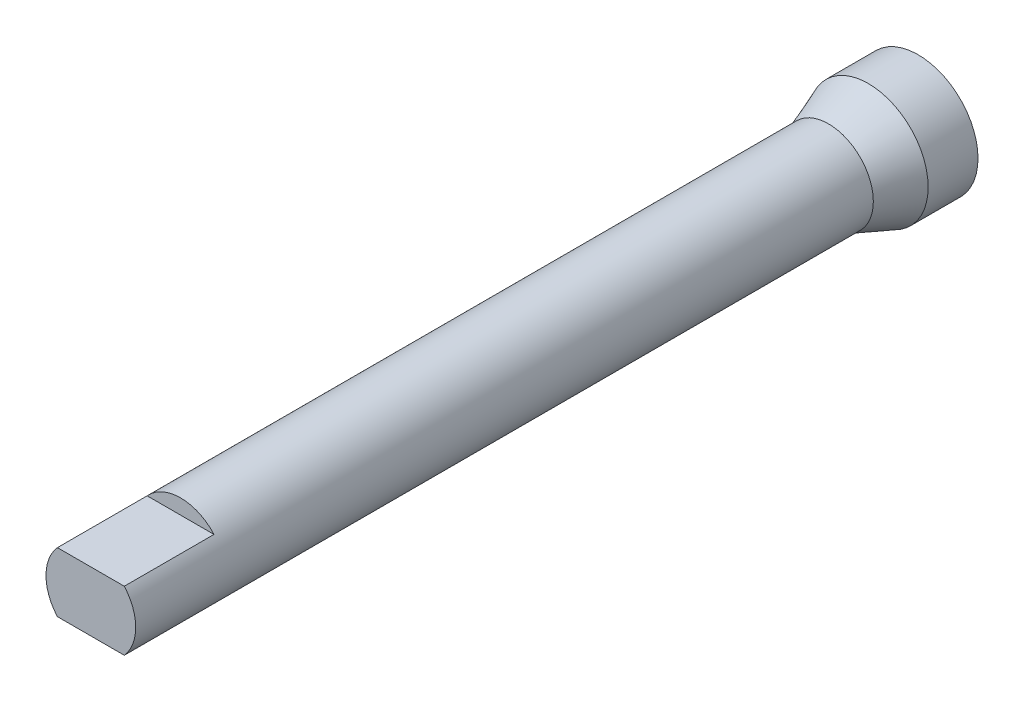
from build123d import *

# Parameters (mm, degrees)
SKETCH3_R           = 22.5
SKETCH3_R_2         = 17.5
BOSS_EXTRUDE1_DEPTH = 320
SKETCH4_R           = 22.5
BOSS_EXTRUDE2_DEPTH = 50
SKETCH5_W           = 33.541019662
SKETCH5_H           = 20
CUT_EXTRUDE1_DEPTH  = 45


with BuildPart() as part:
    # Sketch2 → Revolve1 (revolve)
    with BuildSketch(Plane(origin=(0, 0, 0), x_dir=(1, 0, 0), z_dir=(0, 1, 0))):
        Polygon((-30, 0), (-30, -25), (-22.5, -45), (-17.5, -45), (-25, -25), (-25, 0), align=None)
    revolve(axis=Axis((0, 0, 47.25), (0, 0, -1)))

    # Sketch3 → Boss-Extrude1 (add)
    with BuildSketch(Plane.XY.offset(45)):
        Circle(SKETCH3_R)
        Circle(SKETCH3_R_2, mode=Mode.SUBTRACT)
    extrude(amount=BOSS_EXTRUDE1_DEPTH)

    # Sketch4 → Boss-Extrude2 (add)
    with BuildSketch(Plane.XY.offset(365)):
        Circle(SKETCH4_R)
    extrude(amount=BOSS_EXTRUDE2_DEPTH)

    # Sketch5 → Cut-Extrude1 (cut)
    with BuildSketch(Plane.XY.offset(415)):
        with Locations((0, 25)):
            Rectangle(SKETCH5_W, SKETCH5_H)
        with Locations((0, -25)):
            Rectangle(SKETCH5_W, SKETCH5_H)
    extrude(amount=-CUT_EXTRUDE1_DEPTH, mode=Mode.SUBTRACT)


solid = part.part
